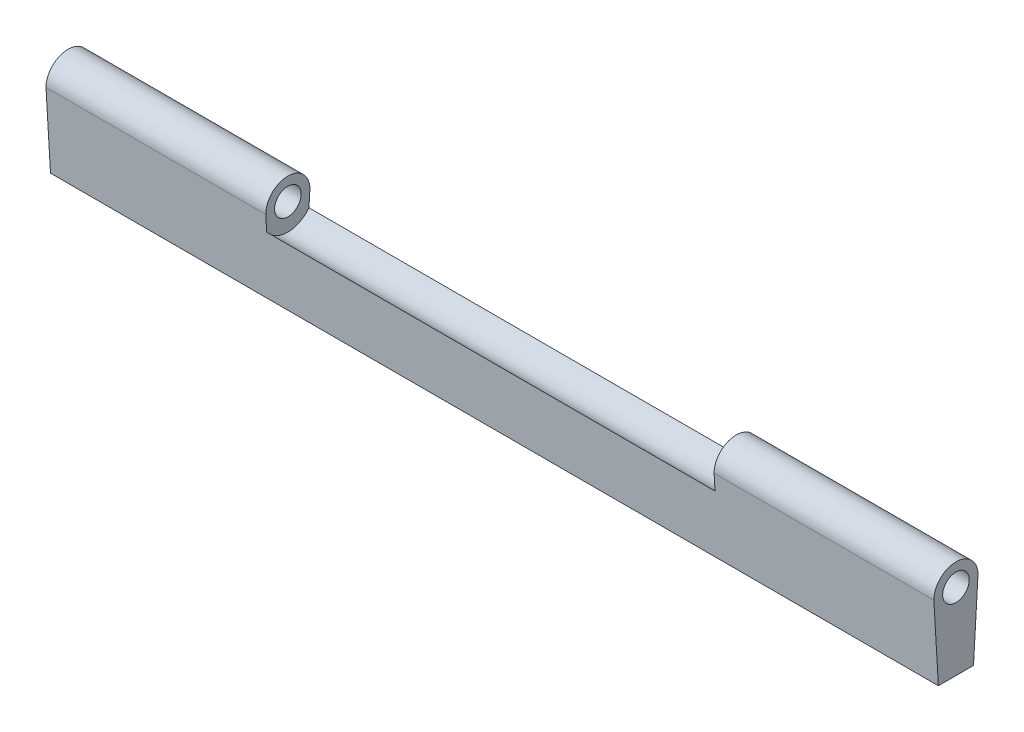
from build123d import *

# Parameters (mm, degrees)
SKETCH1_R           = 1.51
BOSS_EXTRUDE1_DEPTH = 25
BOSS_EXTRUDE2_DEPTH = 51
SKETCH3_R           = 1.51
BOSS_EXTRUDE3_DEPTH = 25


with BuildPart() as part:
    # Sketch1 → Boss-Extrude1 (new body)
    with BuildSketch(Plane(origin=(0, 0, 0), x_dir=(0, 0, -1), z_dir=(1, 0, 0))):
        with BuildLine():
            Line((2, -8.7), (2.51, 0))
            ThreePointArc((2.51, 0), (0, 2.51), (-2.51, 0))
            Line((-2.51, 0), (-2, -8.7))
            Line((-2, -8.7), (2, -8.7))
        make_face()
        Circle(SKETCH1_R, mode=Mode.SUBTRACT)
    extrude(amount=BOSS_EXTRUDE1_DEPTH)

    # Sketch2 → Boss-Extrude2 (add)
    with BuildSketch(Plane(origin=(25, 0, 0), x_dir=(0, 0, -1), z_dir=(1, 0, 0))):
        with BuildLine():
            Line((-2, -8.7), (2, -8.7))
            Line((2, -8.7), (2.403803851, -1.811581366))
            ThreePointArc((2.403803851, -1.811581366), (0, -3.01), (-2.403803851, -1.811581366))
            Line((-2.403803851, -1.811581366), (-2, -8.7))
        make_face()
    extrude(amount=BOSS_EXTRUDE2_DEPTH)

    # Sketch3 → Boss-Extrude3 (add)
    with BuildSketch(Plane(origin=(76, 0, 0), x_dir=(0, 0, -1), z_dir=(1, 0, 0))):
        with BuildLine():
            Line((-2.51, 0), (-2, -8.7))
            Line((-2, -8.7), (2, -8.7))
            Line((2, -8.7), (2.51, 0))
            ThreePointArc((2.51, 0), (0, 2.51), (-2.51, 0))
        make_face()
        Circle(SKETCH3_R, mode=Mode.SUBTRACT)
    extrude(amount=BOSS_EXTRUDE3_DEPTH)


solid = part.part
